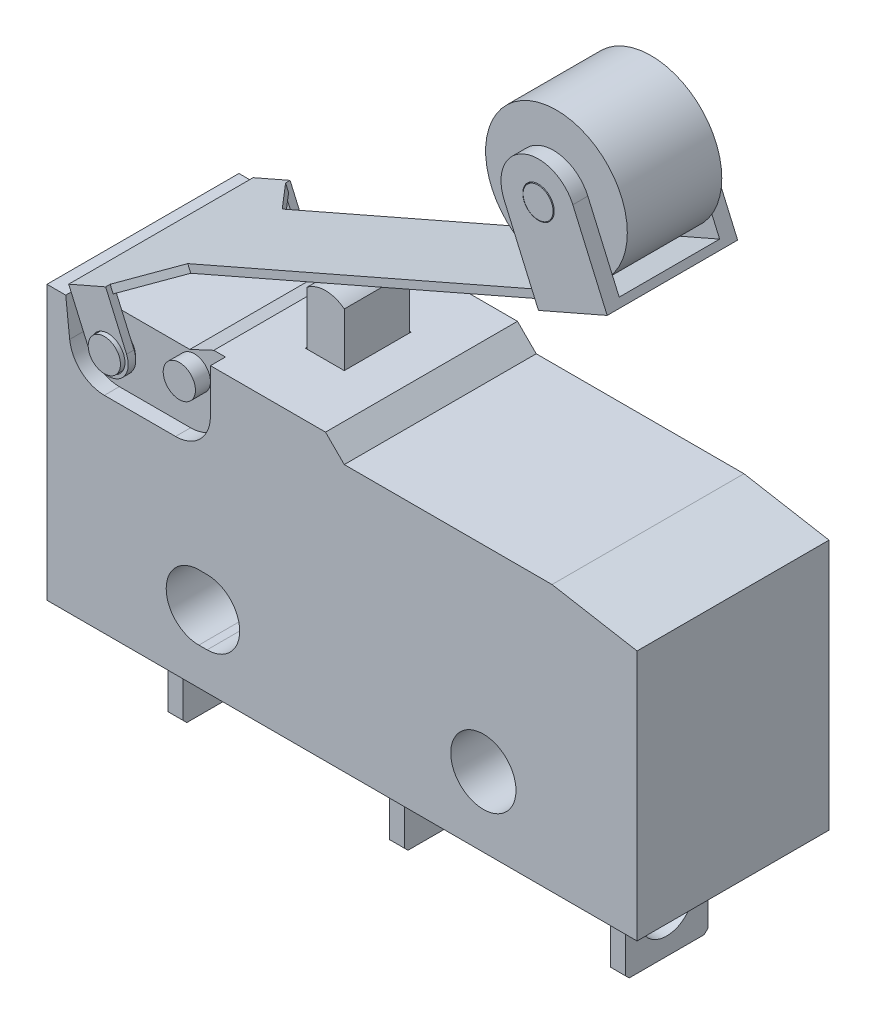
from build123d import *

# Parameters (mm, degrees)
SKETCH2_R            = 1.1049
EXTRUDE1_DEPTH       = 3.2512
EXTRUDE2_DEPTH       = 1.1049
SKETCH4_W            = 1.3208
SKETCH4_H            = 2.2606
CUT_EXTRUDE1_DEPTH   = 1.016
SKETCH5_R            = 0.5461
CUT_EXTRUDE2_DEPTH   = 0.508
SKETCH10_R           = 0.9017
EXTRUDE6_DEPTH       = 0.254
LPATTERN1_COUNT      = 3
LPATTERN1_PITCH      = 7.493
EXTRUDE3_DEPTH       = 1.6002
EXTRUDE4_START       = -0.127
SKETCH8_R            = 0.5715
EXTRUDE4_DEPTH       = 0.254
EXTRUDE5_DEPTH       = 1.27
SKETCH11_R           = 2.4003
EXTRUDE7_DEPTH       = 1.6002
SKETCH12_R           = 0.508
EXTRUDE8_DEPTH       = 2.2225
EXTRUDE9_START       = 0.1016
SKETCH13_R           = 0.5334
EXTRUDE9_DEPTH       = 0.508
EXTRUDE10_DEPTH      = 2.2098
EXTRUDE10_DEPTH_BACK = 2.2098


with BuildPart() as part:
    # Sketch2 → Extrude1 (new, symmetric)
    with BuildSketch(Plane.XY):
        Polygon((9.9949, 8.509), (7.113888836, 9.017), (0.0762, 9.017), (-0.5588, 9.652), (-4.8514, 9.652), (-5.664596778, 9.271), (-9.9949, 9.271), (-9.9949, 0), (9.9949, 0), align=None)
        with Locations((4.7879, 2.3622)):
            Circle(SKETCH2_R, mode=Mode.SUBTRACT)
        with BuildLine():
            Line((-4.8514, 3.4671), (-4.572, 3.4671))
            ThreePointArc((-4.572, 3.4671), (-3.4671, 2.3622), (-4.572, 1.2573))
            Line((-4.572, 1.2573), (-4.8514, 1.2573))
            ThreePointArc((-4.8514, 1.2573), (-5.9563, 2.3622), (-4.8514, 3.4671))
        make_face(mode=Mode.SUBTRACT)
    extrude(amount=EXTRUDE1_DEPTH, both=True)

    # Sketch4 → Cut-Extrude1 (cut)
    with BuildSketch(Plane(origin=(0, 9.652, 0), x_dir=(-1, 0, 0), z_dir=(0, 1, 0))):
        with Locations((2.7051, 0)):
            Rectangle(SKETCH4_W, SKETCH4_H)
    extrude(amount=-CUT_EXTRUDE1_DEPTH, mode=Mode.SUBTRACT)

    # Sketch5 → Cut-Extrude2 (cut)
    with BuildSketch(Plane.XY.offset(3.2512)):
        with BuildLine():
            Line((-8.0518, 6.985), (-5.6388, 6.985))
            ThreePointArc((-5.6388, 6.985), (-4.803636181, 7.330936181), (-4.4577, 8.1661))
            Line((-4.4577, 8.1661), (-4.4577, 9.652))
            Line((-4.4577, 9.652), (-4.8514, 9.652))
            Line((-4.8514, 9.652), (-5.664596778, 9.271))
            Line((-5.664596778, 9.271), (-9.2329, 9.271))
            Line((-9.2329, 9.271), (-9.3599, 9.271))
            Line((-9.3599, 9.271), (-9.225989606, 8.038522651))
            ThreePointArc((-9.225989606, 8.038522651), (-8.840569803, 7.286987147), (-8.0518, 6.985))
        make_face()
        with Locations((-5.5118, 8.6741)):
            Circle(SKETCH5_R, mode=Mode.SUBTRACT)
        with Locations((-8.0518, 8.1661)):
            Circle(SKETCH5_R, mode=Mode.SUBTRACT)
    cut_extrude2 = extrude(amount=-CUT_EXTRUDE2_DEPTH, mode=Mode.SUBTRACT)

    # Mirror1: Cut-Extrude2 across plane
    add(cut_extrude2.mirror(Plane.XY), mode=Mode.SUBTRACT)

    # Sketch10 → Extrude6 (add, symmetric)
    with BuildSketch(Plane(origin=(-7.493, 0, 0), x_dir=(0, 0, -1), z_dir=(1, 0, 0))):
        Polygon((-1.397, 0), (-1.397, -3.0734), (-1.27, -3.2004), (1.27, -3.2004), (1.397, -3.0734), (1.397, 0), align=None)
        with Locations((0, -1.7018)):
            Circle(SKETCH10_R, mode=Mode.SUBTRACT)
    extrude6 = extrude(amount=EXTRUDE6_DEPTH, both=True)

    # LPattern1: Extrude6 ×3
    with Locations(*[(i * LPATTERN1_PITCH, 0, 0) for i in range(1, LPATTERN1_COUNT)]):
        add(extrude6)


with BuildPart() as body_2:
    # Sketch3 → Extrude2 (new, symmetric)
    with BuildSketch(Plane.XY):
        with BuildLine():
            Line((-3.3401, 9.271), (-3.3401, 11.435714746))
            ThreePointArc((-3.3401, 11.435714746), (-2.7051, 11.6586), (-2.0701, 11.435714746))
            Line((-2.0701, 11.435714746), (-2.0701, 9.271))
            Line((-2.0701, 9.271), (-3.3401, 9.271))
        make_face()
    extrude(amount=EXTRUDE2_DEPTH, both=True)


with BuildPart() as body_3:
    # Sketch6 → Extrude3 (new, symmetric)
    with BuildSketch(Plane.XY):
        Polygon((-9.28463618, 9.282907872), (7.941025982, 16.80395694), (7.839390183, 17.036736159), (-9.386271978, 9.51568709), align=None)
    extrude(amount=EXTRUDE3_DEPTH, both=True)


with BuildPart() as body_4:
    # Sketch8 → Extrude4 (new body)
    with BuildSketch(Plane.XY.offset(3.2512).offset(EXTRUDE4_START)):
        with BuildLine():
            Line((-7.425901931, 8.439378905), (-8.134475841, 10.0622449))
            Line((-8.134475841, 10.0622449), (-9.386271978, 9.51568709))
            Line((-9.386271978, 9.51568709), (-8.677698069, 7.892821095))
            ThreePointArc((-8.677698069, 7.892821095), (-7.778521095, 7.540201931), (-7.425901931, 8.439378905))
        make_face()
        with Locations((-8.0518, 8.1661)):
            Circle(SKETCH8_R, mode=Mode.SUBTRACT)
    extrude(amount=-EXTRUDE4_DEPTH)

    # Sketch9 → Extrude5 (add)
    with BuildSketch(Plane.XY.offset(1.6002)):
        Polygon((-8.032840042, 9.829465681), (-8.134475841, 10.0622449), (-9.386271978, 9.51568709), (-9.28463618, 9.282907872), align=None)
    extrude(amount=EXTRUDE5_DEPTH)


with BuildPart() as body_5:
    # Mirror7: mirrored copy
    add(body_4.part.mirror(Plane.XY))

    # Combine1: union body 3, body 4
    add(body_3.part)
    add(body_4.part)



with BuildPart() as body_4_2:
    # Sketch11 → Extrude7 (new, symmetric)
    with BuildSketch(Plane.XY):
        with Locations((5.6134, 18.9611)):
            Circle(SKETCH11_R)
    extrude(amount=EXTRUDE7_DEPTH, both=True)

    # Sketch12 → Extrude8 (add, symmetric)
    with BuildSketch(Plane.XY):
        with Locations((5.6134, 18.9611)):
            Circle(SKETCH12_R)
    extrude(amount=EXTRUDE8_DEPTH, both=True)


with BuildPart() as body_5_2:
    # Sketch13 → Extrude9 (new body)
    with BuildSketch(Plane.XY.offset(1.6002).offset(EXTRUDE9_START)):
        with BuildLine():
            Line((5.613233798, 15.787598958), (7.941025982, 16.80395694))
            Line((7.941025982, 16.80395694), (6.777296092, 19.469278991))
            ThreePointArc((6.777296092, 19.469278991), (5.105221009, 20.124996092), (4.449503908, 18.452921009))
            Line((4.449503908, 18.452921009), (5.613233798, 15.787598958))
        make_face()
        with Locations((5.6134, 18.9611)):
            Circle(SKETCH13_R, mode=Mode.SUBTRACT)
    extrude(amount=EXTRUDE9_DEPTH)


with BuildPart() as body_6:
    # Mirror8: mirrored copy
    add(body_5_2.part.mirror(Plane.XY))


with BuildPart() as body_5_1:
    add(body_5.part)

    add(body_5_2.part)  # Extrude10 merges body 5 2

    add(body_6.part)  # Extrude10 merges body 6
    # Sketch14 → Extrude10 (add, two sides: drawn at the far end of the back side and taken through both)
    with BuildSketch(Plane.XY.offset(-EXTRUDE10_DEPTH_BACK)):
        Polygon((5.613233798, 15.787598958), (5.511597999, 16.020378177), (7.839390183, 17.036736159), (7.941025982, 16.80395694), align=None)
    extrude(amount=EXTRUDE10_DEPTH + EXTRUDE10_DEPTH_BACK)

    # Chamfer1
    # the kernel refuses this chamfer: 1.3716 mm, written as the material it adds along each edge
    with BuildSketch(Plane(origin=(-8.032840042, 9.829465681, -1.6002), x_dir=(-0.025198695538167178, -0.011002225854772951, -0.9996219169112968), z_dir=(-0.4001409378792548, 0.9164536157564716, 0))) as chamfer1_piece_1:
        with BuildLine():
            Line((1.410928155, 0), (-0.077560078, -1.408794766))
            Line((-0.077560078, -1.408794766), (-0.104981706, -1.408040499))
            ThreePointArc((-0.104981706, -1.408040499), (-0.046811648, -0.704176463), (-0.027421628, 0.000754267))
            Line((-0.027421628, 0.000754267), (0.000754267, 0.027421628))
            ThreePointArc((0.000754267, 0.027421628), (0.705684997, 0.008031609), (1.411682421, 0.027421628))
            Line((1.411682421, 0.027421628), (1.410928155, 0))
        make_face()
    extrude(amount=0.254)
    with BuildSketch(Plane(origin=(-8.032840042, 9.829465681, 1.6002), x_dir=(-0.025198695538167178, -0.011002225854772951, 0.9996219169112968), z_dir=(-0.4001409378792548, 0.9164536157564716, 0))) as chamfer1_piece_2:
        with BuildLine():
            Line((1.410928155, 0), (-0.077560078, 1.408794766))
            Line((-0.077560078, 1.408794766), (-0.104981706, 1.408040499))
            ThreePointArc((-0.104981706, 1.408040499), (-0.046811648, 0.704176463), (-0.027421628, -0.000754267))
            Line((-0.027421628, -0.000754267), (0.000754267, -0.027421628))
            ThreePointArc((0.000754267, -0.027421628), (0.705684997, -0.008031609), (1.411682421, -0.027421628))
            Line((1.411682421, -0.027421628), (1.410928155, 0))
        make_face()
    extrude(amount=0.254)


solid = Compound([part.part, body_2.part, body_4_2.part, body_5_1.part])
